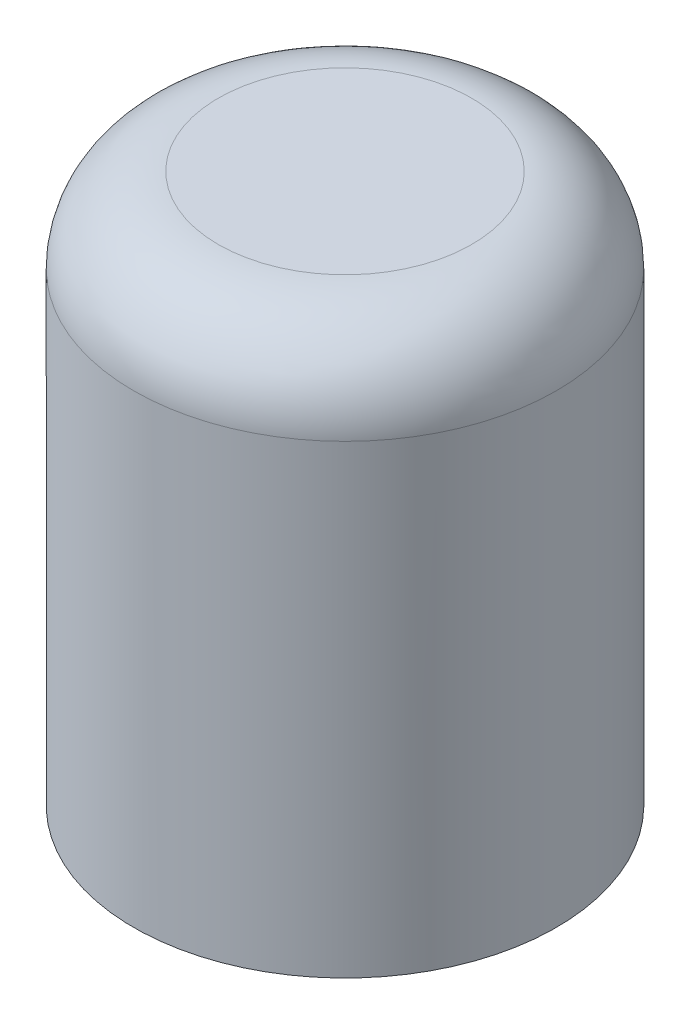
from build123d import *

# Parameters (mm, degrees)
SKETCH1_R           = 5.000000000000002
BOSS_EXTRUDE1_DEPTH = 13
CUT_EXTRUDE1_DEPTH  = 12.5
FILLET4_R           = 2
FILLET5_R           = 0.5
FILLET6_R           = 2


with BuildPart() as part:
    # Sketch1 → Boss-Extrude1 (new body)
    with BuildSketch(Plane(origin=(0, 0, 0), x_dir=(1, 0, 0), z_dir=(0, 1, 0))):
        with Locations(Location((0, 0, 0), (0, 0, 90))):
            Circle(SKETCH1_R)
    extrude(amount=BOSS_EXTRUDE1_DEPTH)

    # Insert → Cut-Extrude1 (cut)
    with BuildSketch(Plane.XZ):
        with BuildLine():
            Line((-1.9999999999999991, 2.872281323269015), (-1.9999999999999991, -2.872281323269015))
            ThreePointArc((-1.9999999999999991, -2.872281323269015), (3.5, 0), (-1.9999999999999991, 2.872281323269015))
        make_face()
    extrude(amount=-CUT_EXTRUDE1_DEPTH, mode=Mode.SUBTRACT)

    # Fillet4
    # the kernel refuses this fillet: 2 mm, written as the material it adds along each edge
    with BuildSketch(Plane(origin=(-1.1e-16, 12.5, 0), x_dir=(-0.9999950652018582, 0, -0.0031415874858792743), z_dir=(-0.0031415874858792743, 0, 0.9999950652018582))) as fillet4_piece_1:
        with BuildLine():
            CenterArc((3.5000000000000004 - FILLET4_R, FILLET4_R), FILLET4_R, 270, 90)
            Line((3.5000000000000004 - FILLET4_R, 0), (3.5000000000000004, 0))
            Line((3.5000000000000004, 0), (3.5000000000000004, FILLET4_R))
        make_face()
    revolve(axis=Axis((-1.1e-16, 12.5, 0), (0, -1, 0)), revolution_arc=359.64)
    with BuildSketch(Plane(origin=(-1.9999999999999991, 12.5, 7.872281323269015), x_dir=(0, -1, 0), z_dir=(0, 0, -1))) as fillet4_piece_2_section:
        with BuildLine():
            CenterArc((FILLET4_R, -FILLET4_R), FILLET4_R, 90, 90)
            Line((0, -FILLET4_R), (0, 0))
            Line((0, 0), (FILLET4_R, 0))
        make_face()
    fillet4_piece_2 = extrude(amount=15.74456264653803, mode=Mode.PRIVATE)
    fillet4_piece_2 = fillet4_piece_2 & Plane(origin=(-1.1e-16, 12.065491957530494, 0), x_dir=(-0.5714285714285712, 0, -0.8206518066482901), z_dir=(0, -1, 0)) * Cylinder(3.5, 40, mode=Mode.PRIVATE)
    add(fillet4_piece_2)

    # Fillet5
    fillet5_edges = [part.edges().sort_by_distance(p)[0] for p in [
        (3.5, 0, -4.4e-16),
        (-1.9999999999999991, 0, 0),
    ]]
    fillet(fillet5_edges, radius=FILLET5_R)

    # Fillet6
    fillet6_edges = [part.edges().sort_by_distance(p)[0] for p in [
        (-9.2e-16, 13, 5.000000000000002),
    ]]
    fillet(fillet6_edges, radius=FILLET6_R)


solid = part.part
